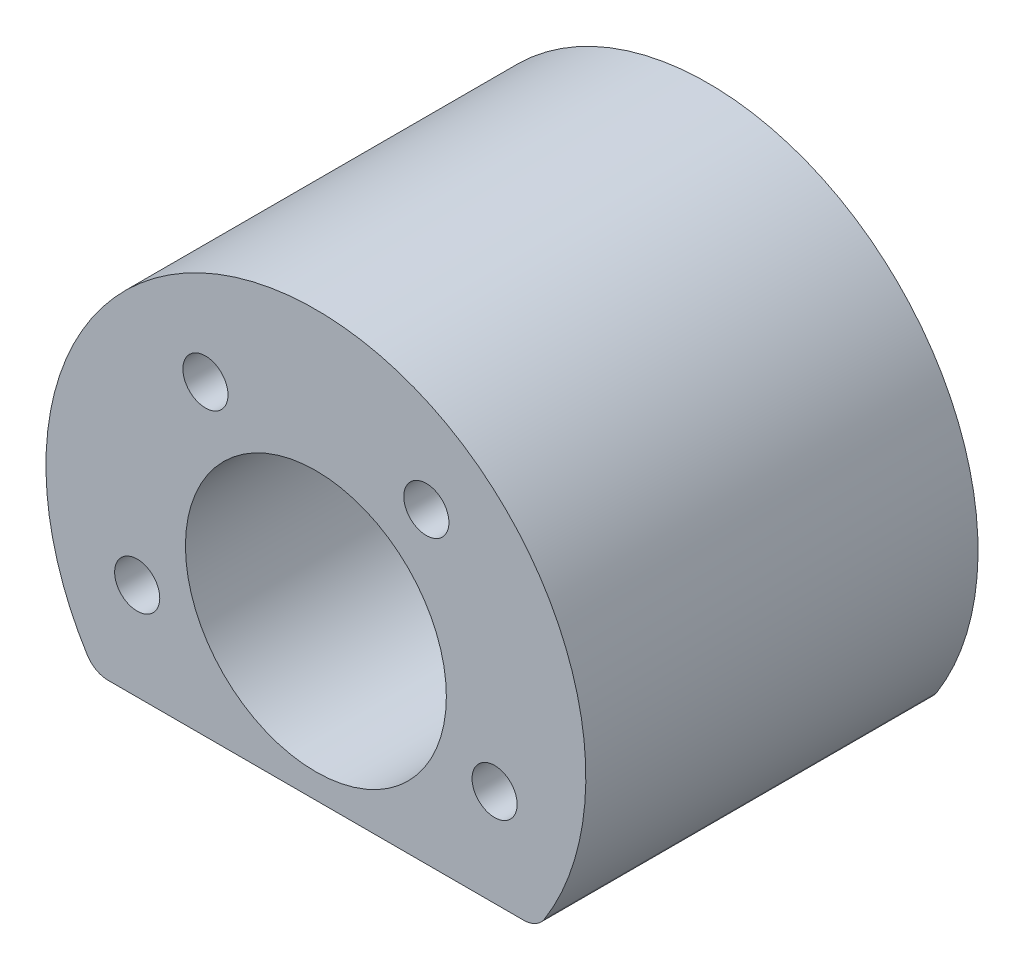
from build123d import *

# Parameters (mm, degrees)
PLAIN_BEARING_RETAINER_SKETCH_R        = 15.9
PLAIN_BEARING_RETAINER_EXTRUSION_DEPTH = 44.8
RETAINER_START                         = -3
RETAINER_WALL_EXTRUDE_OUTLINE_R        = 11
RETAINER_WALL_EXTRUDE_DEPTH            = 3
M5_CLEARANCE_HOLE1_D                   = 5.5
CIRPATTERN1_COUNT                      = 5
FILLET1_R                              = 3
F_6_4MM_M5_INSERT_HOLE_D               = 6.4
F_6_4MM_M5_INSERT_HOLE_DEPTH           = 10
F_6_4MM_M5_INSERT_HOLE_TIP             = 1.922753981


# Read off the part's stored shape, not the designer's step: Retainer Wall Extrude
with BuildPart() as part:
    # Plain Bearing Retainer Sketch → Plain Bearing Retainer Extrusion (new body)
    with BuildSketch(Plane.XY):
        with BuildLine():
            ThreePointArc((32.9, 0), (-9.910302975, 31.371896579), (-26.929537686, -18.9))
            Line((-26.929537686, -18.9), (26.929537686, -18.9))
            ThreePointArc((26.929537686, -18.9), (31.371896579, -9.910302975), (32.9, 0))
        make_face()
        Circle(PLAIN_BEARING_RETAINER_SKETCH_R, mode=Mode.SUBTRACT)
    extrude(amount=PLAIN_BEARING_RETAINER_EXTRUSION_DEPTH)

    # Retainer Wall Extrude outline → Retainer Wall Extrude (add)
    with BuildSketch(Plane.XY.offset(RETAINER_START)):
        with BuildLine():
            Line((-26.929537686, -18.9), (26.929537686, -18.9))
            ThreePointArc((26.929537686, -18.9), (0, 32.9), (-26.929537686, -18.9))
        make_face()
        Circle(RETAINER_WALL_EXTRUDE_OUTLINE_R, mode=Mode.SUBTRACT)
    extrude(amount=RETAINER_WALL_EXTRUDE_DEPTH)

    # M5 Clearance Hole1 (through all)
    with Locations(Plane.XY.offset(44.8)):
        with Locations((13.460282277, 18.526489171)):
            m5_clearance_hole1 = Hole(M5_CLEARANCE_HOLE1_D / 2)

    # CirPattern1: M5 Clearance Hole1 ×5 about axis, 1 skipped
    cirpattern1_axis = Axis((0, 0, 0), (0, 0, -1))
    add([m5_clearance_hole1.rotate(cirpattern1_axis, i * 360 / CIRPATTERN1_COUNT) for i in range(1, CIRPATTERN1_COUNT) if i not in (2,)], mode=Mode.SUBTRACT)

    # Fillet1
    fillet1_edges = [part.edges().sort_by_distance(p)[0] for p in [
        (-26.929537686, -18.9, 22.4),
        (26.929537686, -18.9, 22.4),
    ]]
    fillet(fillet1_edges, radius=FILLET1_R)

    # Ø6.4mm M5 Insert Hole
    with Locations(Plane(origin=(0, 0, -3), x_dir=(-1, 0, 0), z_dir=(0, 0, -1))):
        with Locations((-13.460282277, 18.526489171), (-21.779194223, -7.076489171), (21.779194223, -7.076489171), (13.460282277, 18.526489171)):
            Hole(F_6_4MM_M5_INSERT_HOLE_D / 2, depth=F_6_4MM_M5_INSERT_HOLE_DEPTH)
            with Locations((0, 0, -(F_6_4MM_M5_INSERT_HOLE_DEPTH + F_6_4MM_M5_INSERT_HOLE_TIP / 2))):  # 118° drill point
                Cone(0, F_6_4MM_M5_INSERT_HOLE_D / 2, F_6_4MM_M5_INSERT_HOLE_TIP, mode=Mode.SUBTRACT)


solid = part.part
